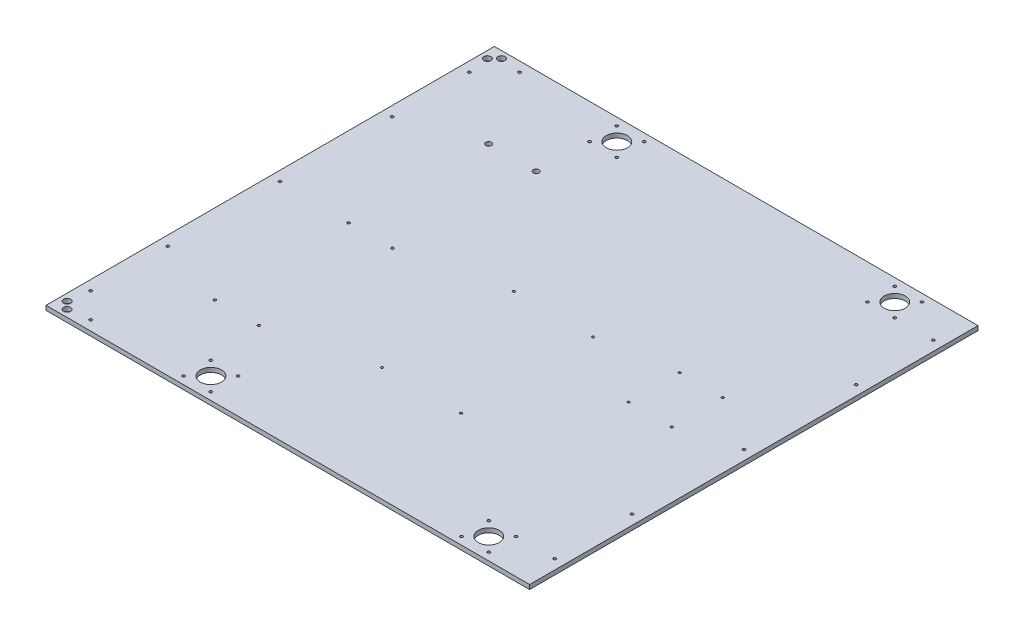
from build123d import *

# Parameters (mm, degrees)
SKETCH1_W                               = 510
SKETCH1_H                               = 5
BOSS_EXTRUDE1_DEPTH                     = 550
BOTTHOMHOLES_SKETCH2_R                  = 12
BOTTHOMHOLES_SKETCH2_R_2                = 1.5875
BOTTOMENCLOSUREHOLES_CUT_EXTRUDE1_DEPTH = 751.083328704
BOTTOMPSUHOLESSKETCH2_R                 = 1.5
BOTTOMPSUHOLESSKETCH2_R_2               = 3.25
BOTTOMPSUHOLESCUT_EXTRUDE1_DEPTH        = 751.083328704
RPIHOLESSKETCH2_R                       = 1.35
RPIHOLESCUT_EXTRUDE1_DEPTH              = 751.083328704
CABLEHOLESSKETCH2_R                     = 4
CABLEHOLESCUT_EXTRUDE1_DEPTH            = 751.083328704
OCTOPUSHOLESSKETCH2_R                   = 1.35
OCTOPUSHOLESCUT_EXTRUDE1_DEPTH          = 751.083328704


with BuildPart() as part:
    # Sketch1 → Boss-Extrude1 (new body)
    with BuildSketch(Plane(origin=(0, 0, 0), x_dir=(0, 0, -1), z_dir=(1, 0, 0))):
        with Locations((-255, 2.5)):
            Rectangle(SKETCH1_W, SKETCH1_H)
    extrude(amount=BOSS_EXTRUDE1_DEPTH)

    # BotthomHoles-Sketch2 → BottomEnclosureHoles-Cut-Extrude1 (cut, through all)
    with BuildSketch(Plane(origin=(0, 5, 0), x_dir=(1, 0, 0), z_dir=(0, 1, 0))):
        with Locations((479.425, -24.175)):
            Circle(BOTTHOMHOLES_SKETCH2_R)
        with Locations((463.925, -8.675)):
            Circle(BOTTHOMHOLES_SKETCH2_R_2)
        with Locations((494.925, -8.675)):
            Circle(BOTTHOMHOLES_SKETCH2_R_2)
        with Locations((463.925, -39.675)):
            Circle(BOTTHOMHOLES_SKETCH2_R_2)
        with Locations((494.925, -39.675)):
            Circle(BOTTHOMHOLES_SKETCH2_R_2)
        with Locations((39.6875, -11.1125)):
            Circle(BOTTHOMHOLES_SKETCH2_R_2)
        with Locations((178.925, -39.675)):
            Circle(BOTTHOMHOLES_SKETCH2_R_2)
        with Locations((147.925, -39.675)):
            Circle(BOTTHOMHOLES_SKETCH2_R_2)
        with Locations((178.925, -8.675)):
            Circle(BOTTHOMHOLES_SKETCH2_R_2)
        with Locations((147.925, -8.675)):
            Circle(BOTTHOMHOLES_SKETCH2_R_2)
        with Locations((163.425, -24.175)):
            Circle(BOTTHOMHOLES_SKETCH2_R)
        with Locations((39.6875, -498.8875)):
            Circle(BOTTHOMHOLES_SKETCH2_R_2)
        with Locations((147.925, -501.325)):
            Circle(BOTTHOMHOLES_SKETCH2_R_2)
        with Locations((178.925, -501.325)):
            Circle(BOTTHOMHOLES_SKETCH2_R_2)
        with Locations((147.925, -470.325)):
            Circle(BOTTHOMHOLES_SKETCH2_R_2)
        with Locations((178.925, -470.325)):
            Circle(BOTTHOMHOLES_SKETCH2_R_2)
        with Locations((463.925, -470.325)):
            Circle(BOTTHOMHOLES_SKETCH2_R_2)
        with Locations((463.925, -501.325)):
            Circle(BOTTHOMHOLES_SKETCH2_R_2)
        with Locations((494.925, -470.325)):
            Circle(BOTTHOMHOLES_SKETCH2_R_2)
        with Locations((494.925, -501.325)):
            Circle(BOTTHOMHOLES_SKETCH2_R_2)
        with Locations((163.425, -485.825)):
            Circle(BOTTHOMHOLES_SKETCH2_R)
        with Locations((479.425, -485.825)):
            Circle(BOTTHOMHOLES_SKETCH2_R)
        with Locations((11.1125, -39.6875)):
            Circle(BOTTHOMHOLES_SKETCH2_R_2)
        with Locations((11.1125, -127.5)):
            Circle(BOTTHOMHOLES_SKETCH2_R_2)
        with Locations((11.1125, -255)):
            Circle(BOTTHOMHOLES_SKETCH2_R_2)
        with Locations((11.1125, -382.5)):
            Circle(BOTTHOMHOLES_SKETCH2_R_2)
        with Locations((11.1125, -470.3125)):
            Circle(BOTTHOMHOLES_SKETCH2_R_2)
        with Locations((538.8875, -470.3125)):
            Circle(BOTTHOMHOLES_SKETCH2_R_2)
        with Locations((538.8875, -382.5)):
            Circle(BOTTHOMHOLES_SKETCH2_R_2)
        with Locations((538.8875, -255)):
            Circle(BOTTHOMHOLES_SKETCH2_R_2)
        with Locations((538.8875, -127.5)):
            Circle(BOTTHOMHOLES_SKETCH2_R_2)
        with Locations((538.8875, -39.6875)):
            Circle(BOTTHOMHOLES_SKETCH2_R_2)
    extrude(amount=-BOTTOMENCLOSUREHOLES_CUT_EXTRUDE1_DEPTH, mode=Mode.SUBTRACT)

    # BottomPSUHolesSketch2 → BottomPSUHolesCut-Extrude1 (cut, through all)
    with BuildSketch(Plane(origin=(0, 5, 0), x_dir=(1, 0, 0), z_dir=(0, 1, 0))):
        with Locations((90.8, -256.7)):
            Circle(BOTTOMPSUHOLESSKETCH2_R)
        with Locations((140.8, -256.7)):
            Circle(BOTTOMPSUHOLESSKETCH2_R)
        with Locations((90.8, -408.7)):
            Circle(BOTTOMPSUHOLESSKETCH2_R)
        with Locations((140.8, -408.7)):
            Circle(BOTTOMPSUHOLESSKETCH2_R)
        with Locations((92.8, -99.3)):
            Circle(BOTTOMPSUHOLESSKETCH2_R_2)
        with Locations((146.8, -99.3)):
            Circle(BOTTOMPSUHOLESSKETCH2_R_2)
    extrude(amount=-BOTTOMPSUHOLESCUT_EXTRUDE1_DEPTH, mode=Mode.SUBTRACT)

    # RPIHolesSketch2 → RPIHolesCut-Extrude1 (cut, through all)
    with BuildSketch(Plane(origin=(0, 5, 0), x_dir=(1, 0, 0), z_dir=(0, 1, 0))):
        with Locations((426.7, -216)):
            Circle(RPIHOLESSKETCH2_R)
        with Locations((475.7, -216)):
            Circle(RPIHOLESSKETCH2_R)
        with Locations((426.7, -274)):
            Circle(RPIHOLESSKETCH2_R)
        with Locations((475.7, -274)):
            Circle(RPIHOLESSKETCH2_R)
    extrude(amount=-RPIHOLESCUT_EXTRUDE1_DEPTH, mode=Mode.SUBTRACT)

    # CableHolesSketch2 → CableHolesCut-Extrude1 (cut, through all)
    with BuildSketch(Plane(origin=(0, 5, 0), x_dir=(1, 0, 0), z_dir=(0, 1, 0))):
        with Locations((8, -494)):
            Circle(CABLEHOLESSKETCH2_R)
        with Locations((16, -502)):
            Circle(CABLEHOLESSKETCH2_R)
        with Locations((8, -16)):
            Circle(CABLEHOLESSKETCH2_R)
        with Locations((16, -8)):
            Circle(CABLEHOLESSKETCH2_R)
    extrude(amount=-CABLEHOLESCUT_EXTRUDE1_DEPTH, mode=Mode.SUBTRACT)

    # OctopusHolesSketch2 → OctopusHolesCut-Extrude1 (cut, through all)
    with BuildSketch(Plane(origin=(0, 5, 0), x_dir=(1, 0, 0), z_dir=(0, 1, 0))):
        with Locations((252.3, -230.2)):
            Circle(OCTOPUSHOLESSKETCH2_R)
        with Locations((252.3, -380.2)):
            Circle(OCTOPUSHOLESSKETCH2_R)
        with Locations((342.3, -230.2)):
            Circle(OCTOPUSHOLESSKETCH2_R)
        with Locations((342.3, -380.2)):
            Circle(OCTOPUSHOLESSKETCH2_R)
    extrude(amount=-OCTOPUSHOLESCUT_EXTRUDE1_DEPTH, mode=Mode.SUBTRACT)


solid = part.part
